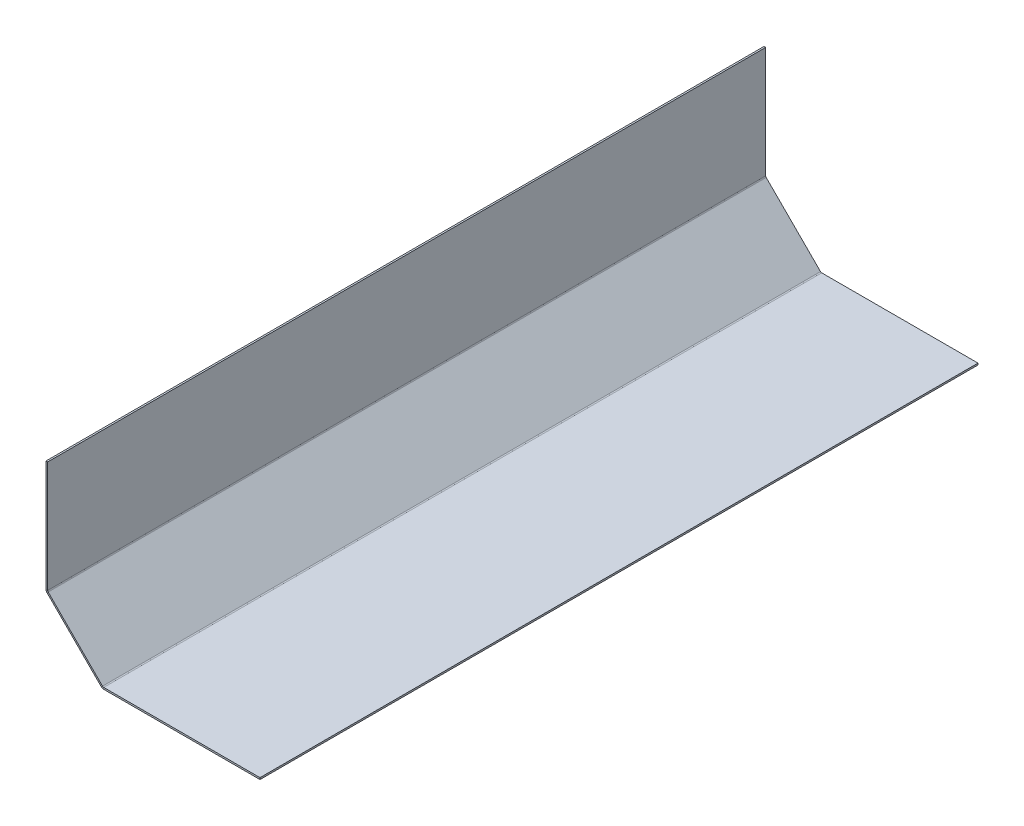
from build123d import *

# Parameters (mm, degrees)
TABAN_FLAN_1_DEPTH = 2550


# Sheet-metal steps are written as plain solids
with BuildPart() as part:
    # Çizim1 → Taban-Flanş1 (new body)
    with BuildSketch(Plane.XY):
        with BuildLine():
            Line((0, 0), (0, -395.029437252))
            ThreePointArc((0, -395.029437252), (0.91344561, -399.62163844), (3.514718626, -403.514718626))
            Line((3.514718626, -403.514718626), (196.485281374, -596.485281374))
            ThreePointArc((196.485281374, -596.485281374), (200.37836156, -599.08655439), (204.970562748, -600))
            Line((204.970562748, -600), (760, -600))
            Line((760, -600), (760, -594))
            Line((760, -594), (204.970562748, -594))
            ThreePointArc((204.970562748, -594), (202.674462154, -593.543277195), (200.727922061, -592.242640687))
            Line((200.727922061, -592.242640687), (7.757359313, -399.272077939))
            ThreePointArc((7.757359313, -399.272077939), (6.456722805, -397.325537846), (6, -395.029437252))
            Line((6, -395.029437252), (6, 0))
            Line((6, 0), (0, 0))
        make_face()
    extrude(amount=-TABAN_FLAN_1_DEPTH)


solid = part.part
